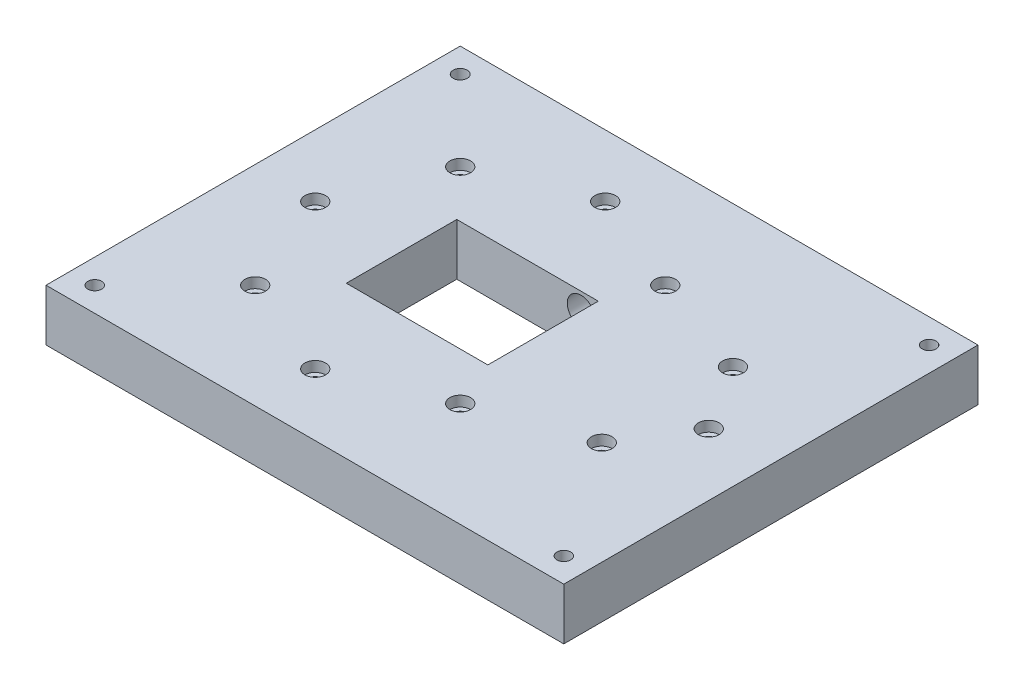
from build123d import *

# Parameters (mm, degrees)
SKETCH1_W           = 150
SKETCH1_H           = 120
SKETCH1_R           = 1.55
SKETCH1_R_2         = 2.05
SKETCH1_R_3         = 2
SKETCH1_W_2         = 41
SKETCH1_H_2         = 32
BOSS_EXTRUDE1_DEPTH = 15
SKETCH2_R           = 3
CUT_EXTRUDE1_DEPTH  = 3
SKETCH3_R           = 4
CUT_EXTRUDE2_DEPTH  = 44


with BuildPart() as part:
    # Sketch1 → Boss-Extrude1 (new body)
    with BuildSketch(Plane(origin=(0, 0, 0), x_dir=(1, 0, 0), z_dir=(0, 1, 0))):
        with Locations((-2e-09, 2e-09)):
            Rectangle(SKETCH1_W, SKETCH1_H)
        with Locations((14.69848481, 29.69848481)):
            Circle(SKETCH1_R, mode=Mode.SUBTRACT)
        with Locations((-15, 42)):
            Circle(SKETCH1_R, mode=Mode.SUBTRACT)
        with Locations((-44.69848481, 29.69848481)):
            Circle(SKETCH1_R, mode=Mode.SUBTRACT)
        with Locations((-57, 0)):
            Circle(SKETCH1_R, mode=Mode.SUBTRACT)
        with Locations((-44.69848481, -29.69848481)):
            Circle(SKETCH1_R, mode=Mode.SUBTRACT)
        with Locations((-15, -42)):
            Circle(SKETCH1_R, mode=Mode.SUBTRACT)
        with Locations((14.69848481, -29.69848481)):
            Circle(SKETCH1_R, mode=Mode.SUBTRACT)
        with Locations((45, -19)):
            Circle(SKETCH1_R, mode=Mode.SUBTRACT)
        with Locations((57, 0)):
            Circle(SKETCH1_R, mode=Mode.SUBTRACT)
        with Locations((45, 19)):
            Circle(SKETCH1_R, mode=Mode.SUBTRACT)
        with Locations((-67.92893219, 52.92893219)):
            Circle(SKETCH1_R_2, mode=Mode.SUBTRACT)
        with Locations((67.928932186, -52.928932186)):
            Circle(SKETCH1_R_3, mode=Mode.SUBTRACT)
        with Locations((-67.92893219, -52.928932186)):
            Circle(SKETCH1_R_3, mode=Mode.SUBTRACT)
        with Locations((67.928932186, 52.92893219)):
            Circle(SKETCH1_R_3, mode=Mode.SUBTRACT)
        with Locations((-11.5, 0)):
            Rectangle(SKETCH1_W_2, SKETCH1_H_2, mode=Mode.SUBTRACT)
    extrude(amount=BOSS_EXTRUDE1_DEPTH)

    # Sketch2 → Cut-Extrude1 (cut)
    with BuildSketch(Plane(origin=(0, 15, 0), x_dir=(1, 0, 0), z_dir=(0, 1, 0))):
        with Locations((14.69848481, 29.69848481)):
            Circle(SKETCH2_R)
        with Locations((-15, 42)):
            Circle(SKETCH2_R)
        with Locations((-44.69848481, 29.69848481)):
            Circle(SKETCH2_R)
        with Locations((-57, 0)):
            Circle(SKETCH2_R)
        with Locations((-44.69848481, -29.69848481)):
            Circle(SKETCH2_R)
        with Locations((-15, -42)):
            Circle(SKETCH2_R)
        with Locations((14.69848481, -29.69848481)):
            Circle(SKETCH2_R)
        with Locations((45, -19)):
            Circle(SKETCH2_R)
        with Locations((57, 0)):
            Circle(SKETCH2_R)
        with Locations((45, 19)):
            Circle(SKETCH2_R)
    extrude(amount=-CUT_EXTRUDE1_DEPTH, mode=Mode.SUBTRACT)

    # Sketch3 → Cut-Extrude2 (cut)
    with BuildSketch(Plane.XY.offset(-16)):
        with Locations((4, 10)):
            Circle(SKETCH3_R)
    extrude(amount=-CUT_EXTRUDE2_DEPTH, mode=Mode.SUBTRACT)


solid = part.part
